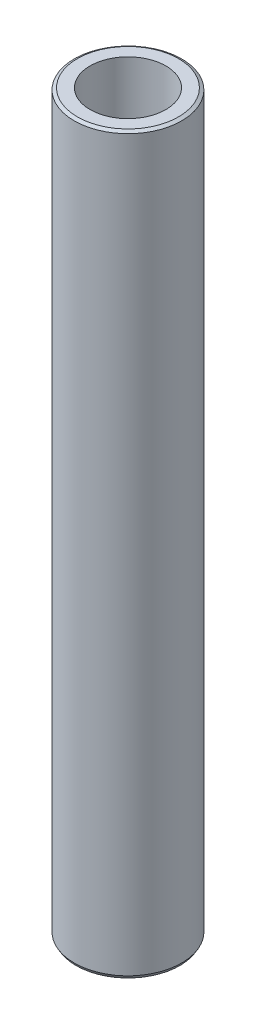
from build123d import *
from OCP.BRepFilletAPI import BRepFilletAPI_MakeChamfer

# Parameters (mm, degrees)
SKETCH1_R           = 27.5
BOSS_EXTRUDE1_DEPTH = 375.95370183
SKETCH2_R           = 19.399505176
CUT_EXTRUDE1_DEPTH  = 378.959899883
CHAMFER1_SIZE       = 0.938885212
CHAMFER1_SIZE2      = 1.626196889


with BuildPart() as part:
    # Sketch1 → Boss-Extrude1 (new body)
    with BuildSketch(Plane(origin=(0, 0, 0), x_dir=(1, 0, 0), z_dir=(0, 1, 0))):
        Circle(SKETCH1_R)
    extrude(amount=BOSS_EXTRUDE1_DEPTH)

    # Sketch2 → Cut-Extrude1 (cut, through all)
    with BuildSketch(Plane(origin=(0, 0, 0), x_dir=(1, 0, 0), z_dir=(0, 1, 0))):
        Circle(SKETCH2_R)
    extrude(amount=CUT_EXTRUDE1_DEPTH, mode=Mode.SUBTRACT)

    # Chamfer1: one chamfer whose edges measure the first distance from different faces: ONE call of the kernel's chamfer builder (chamfer() names one face for all edges)
    chamfer1_edges_1 = [part.edges().sort_by_distance(p)[0] for p in [
        (-27.5, 375.95370183, 0),
    ]]
    chamfer1_side_1 = [part.faces().sort_by_distance(p)[0] for p in [
        (-27.5, 187.976850915, 0),
    ]]
    chamfer1_edges_2 = [part.edges().sort_by_distance(p)[0] for p in [
        (-27.5, 0, 0),
    ]]
    chamfer1_side_2 = [part.faces().sort_by_distance(p)[0] for p in [
        (-26.722182541, 0, 0),
    ]]
    chamfer1 = BRepFilletAPI_MakeChamfer(part.part.solid().wrapped)
    for e in chamfer1_edges_1:
        chamfer1.Add(CHAMFER1_SIZE, CHAMFER1_SIZE2, e.wrapped, chamfer1_side_1[0].wrapped)  # the first distance lies on this face
    for e in chamfer1_edges_2:
        chamfer1.Add(CHAMFER1_SIZE, CHAMFER1_SIZE2, e.wrapped, chamfer1_side_2[0].wrapped)  # the first distance lies on this face
    add(Compound.cast(chamfer1.Shape()), mode=Mode.REPLACE)


solid = part.part
